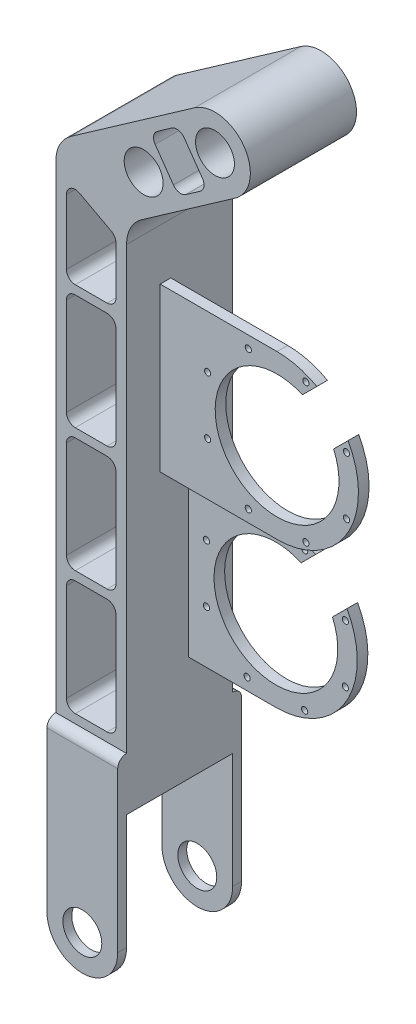
from build123d import *

# Parameters (mm, degrees)
SKETCH_1_R           = 20
SKETCH_1_R_2         = 11
EXTRUDE_1_DEPTH      = 60
EXTRUDE_2_DEPTH      = 30
SKETCH_4_R           = 11
EXTRUDE_3_DEPTH      = 5
SKETCH_8_R           = 11
CUT_EXTRUDE_1_DEPTH  = 100
FILLET_4_R           = 20
EXTRUDE_START        = -19
SKETCH_18_R          = 35
EXTRUDE_4_DEPTH      = 6
SKETCH_19_R          = 35
EXTRUDE_5_DEPTH      = 6
CUT_EXTRUDE_10_REACH = 447.736
SKETCH_22_R          = 1.75
SKETCH_23_W          = 28
SKETCH_23_H          = 65
CUT_EXTRUDE_11_DEPTH = 60
FILLET_6_R           = 5
CUT_EXTRUDE_12_REACH = 447.736


with BuildPart() as part:
    # 草图1 → 凸台-拉伸1 (new body)
    with BuildSketch(Plane.XY):
        Circle(SKETCH_1_R)
        Circle(SKETCH_1_R_2, mode=Mode.SUBTRACT)
    extrude(amount=EXTRUDE_1_DEPTH)

    # 草图2 → 凸台-拉伸2 (add, symmetric)
    with BuildSketch(Plane.XY.offset(30)):
        with BuildLine():
            Line((-11.471528727, 16.383040886), (-90, -38.603186664))
            Line((-90, -38.603186664), (-90, -349.014527675))
            Line((-90, -349.014527675), (-50, -349.014527675))
            Line((-50, -349.014527675), (-50, -59.425868686))
            Line((-50, -59.425868686), (11.471528727, -16.383040886))
            ThreePointArc((11.471528727, -16.383040886), (-16.383040886, -11.471528727), (-11.471528727, 16.383040886))
        make_face()
    extrude(amount=EXTRUDE_2_DEPTH, both=True)

    # 草图4 → 凸台-拉伸3 (add)
    with BuildSketch(Plane.XY.offset(60)):
        with BuildLine():
            Line((-90, -319.014527675), (-50, -319.014527675))
            Line((-50, -319.014527675), (-50, -414.125584817))
            ThreePointArc((-50, -414.125584817), (-70, -434.125584817), (-90, -414.125584817))
            Line((-90, -414.125584817), (-90, -319.014527675))
        make_face()
        with Locations((-70, -414.125584817)):
            Circle(SKETCH_4_R, mode=Mode.SUBTRACT)
    extrude_3 = extrude(amount=EXTRUDE_3_DEPTH)

    # 草图8 → 切除-拉伸1 (cut)
    with BuildSketch(Plane.XY.offset(60)):
        with Locations((-40.329488414, -29.555580933)):
            Circle(SKETCH_8_R)
    extrude(amount=-CUT_EXTRUDE_1_DEPTH, mode=Mode.SUBTRACT)

    # 镜向1: 凸台-拉伸3 across plane
    add(extrude_3.mirror(Plane.XY.offset(30)))

    # 圆角4
    fillet_4_edges = [part.edges().sort_by_distance(p)[0] for p in [
        (-50, -59.425868686, 30),
        (-90, -38.603186664, 30),
    ]]
    fillet(fillet_4_edges, radius=FILLET_4_R)

    # 草图18 → 凸台-拉伸4 (add)
    with BuildSketch(Plane.XY.offset(60).offset(EXTRUDE_START)):
        with BuildLine():
            Line((-50, -98.708528272), (-50, -190.708528272))
            Line((-50, -190.708528272), (16.107198554, -190.708528272))
            ThreePointArc((16.107198554, -190.708528272), (62.107198554, -144.708528272), (16.107198554, -98.708528272))
            Line((16.107198554, -98.708528272), (-50, -98.708528272))
        make_face()
        with Locations((16.107198554, -144.708528272)):
            Circle(SKETCH_18_R, mode=Mode.SUBTRACT)
    extrude(amount=-EXTRUDE_4_DEPTH)

    # 草图19 → 凸台-拉伸5 (add)
    with BuildSketch(Plane(origin=(0, 0, 0), x_dir=(-1, 0, 0), z_dir=(0, 0, -1)).offset(EXTRUDE_START)):
        with BuildLine():
            Line((50, -197.309857991), (50, -289.309857991))
            Line((50, -289.309857991), (0.559468113, -289.309857991))
            ThreePointArc((0.559468113, -289.309857991), (-45.440531887, -243.309857991), (0.559468113, -197.309857991))
            Line((0.559468113, -197.309857991), (50, -197.309857991))
        make_face()
        with Locations((0.559468113, -243.309857991)):
            Circle(SKETCH_19_R, mode=Mode.SUBTRACT)
    extrude(amount=-EXTRUDE_5_DEPTH)

    # 切除-拉伸10: up to this face of the body (flat: up to its plane)
    cut_extrude_10_end = Plane(part.part.faces().sort_by_distance((-25.279734056, -198.63548596, 19))[0])
    # 草图22 → 切除-拉伸10 (cut, up to the picked face)
    with BuildSketch(Plane.XY.offset(41), mode=Mode.PRIVATE) as cut_extrude_10_sk1:
        with Locations((32.37124443, -105.443648141)):
            Circle(SKETCH_22_R)
    cut_extrude_10_tool1 = split(extrude(cut_extrude_10_sk1.sketch, amount=-CUT_EXTRUDE_10_REACH, mode=Mode.PRIVATE), bisect_by=cut_extrude_10_end, keep=Keep.BOTH, mode=Mode.PRIVATE)
    # 草图22 → 切除-拉伸10 (cut, up to the picked face)
    with BuildSketch(Plane.XY.offset(41), mode=Mode.PRIVATE) as cut_extrude_10_sk2:
        with Locations((55.372078686, -128.444482397)):
            Circle(SKETCH_22_R)
    cut_extrude_10_tool2 = split(extrude(cut_extrude_10_sk2.sketch, amount=-CUT_EXTRUDE_10_REACH, mode=Mode.PRIVATE), bisect_by=cut_extrude_10_end, keep=Keep.BOTH, mode=Mode.PRIVATE)
    # 草图22 → 切除-拉伸10 (cut, up to the picked face)
    with BuildSketch(Plane.XY.offset(41), mode=Mode.PRIVATE) as cut_extrude_10_sk3:
        with Locations((55.372078686, -160.972574148)):
            Circle(SKETCH_22_R)
    cut_extrude_10_tool3 = split(extrude(cut_extrude_10_sk3.sketch, amount=-CUT_EXTRUDE_10_REACH, mode=Mode.PRIVATE), bisect_by=cut_extrude_10_end, keep=Keep.BOTH, mode=Mode.PRIVATE)
    # 草图22 → 切除-拉伸10 (cut, up to the picked face)
    with BuildSketch(Plane.XY.offset(41), mode=Mode.PRIVATE) as cut_extrude_10_sk4:
        with Locations((32.37124443, -183.973408404)):
            Circle(SKETCH_22_R)
    cut_extrude_10_tool4 = split(extrude(cut_extrude_10_sk4.sketch, amount=-CUT_EXTRUDE_10_REACH, mode=Mode.PRIVATE), bisect_by=cut_extrude_10_end, keep=Keep.BOTH, mode=Mode.PRIVATE)
    # 草图22 → 切除-拉伸10 (cut, up to the picked face)
    with BuildSketch(Plane.XY.offset(41), mode=Mode.PRIVATE) as cut_extrude_10_sk5:
        with Locations((-0.156847322, -183.973408404)):
            Circle(SKETCH_22_R)
    cut_extrude_10_tool5 = split(extrude(cut_extrude_10_sk5.sketch, amount=-CUT_EXTRUDE_10_REACH, mode=Mode.PRIVATE), bisect_by=cut_extrude_10_end, keep=Keep.BOTH, mode=Mode.PRIVATE)
    # 草图22 → 切除-拉伸10 (cut, up to the picked face)
    with BuildSketch(Plane.XY.offset(41), mode=Mode.PRIVATE) as cut_extrude_10_sk6:
        with Locations((-23.157681578, -160.972574148)):
            Circle(SKETCH_22_R)
    cut_extrude_10_tool6 = split(extrude(cut_extrude_10_sk6.sketch, amount=-CUT_EXTRUDE_10_REACH, mode=Mode.PRIVATE), bisect_by=cut_extrude_10_end, keep=Keep.BOTH, mode=Mode.PRIVATE)
    # 草图22 → 切除-拉伸10 (cut, up to the picked face)
    with BuildSketch(Plane.XY.offset(41), mode=Mode.PRIVATE) as cut_extrude_10_sk7:
        with Locations((-23.157681578, -128.444482397)):
            Circle(SKETCH_22_R)
    cut_extrude_10_tool7 = split(extrude(cut_extrude_10_sk7.sketch, amount=-CUT_EXTRUDE_10_REACH, mode=Mode.PRIVATE), bisect_by=cut_extrude_10_end, keep=Keep.BOTH, mode=Mode.PRIVATE)
    # 草图22 → 切除-拉伸10 (cut, up to the picked face)
    with BuildSketch(Plane.XY.offset(41), mode=Mode.PRIVATE) as cut_extrude_10_sk8:
        with Locations((-0.156847322, -105.443648141)):
            Circle(SKETCH_22_R)
    cut_extrude_10_tool8 = split(extrude(cut_extrude_10_sk8.sketch, amount=-CUT_EXTRUDE_10_REACH, mode=Mode.PRIVATE), bisect_by=cut_extrude_10_end, keep=Keep.BOTH, mode=Mode.PRIVATE)
    # 草图22 → 切除-拉伸10 (cut, up to the picked face)
    with BuildSketch(Plane.XY.offset(41), mode=Mode.PRIVATE) as cut_extrude_10_sk9:
        with Locations((15.704577763, -204.044977859)):
            Circle(SKETCH_22_R)
    cut_extrude_10_tool9 = split(extrude(cut_extrude_10_sk9.sketch, amount=-CUT_EXTRUDE_10_REACH, mode=Mode.PRIVATE), bisect_by=cut_extrude_10_end, keep=Keep.BOTH, mode=Mode.PRIVATE)
    # 草图22 → 切除-拉伸10 (cut, up to the picked face)
    with BuildSketch(Plane.XY.offset(41), mode=Mode.PRIVATE) as cut_extrude_10_sk10:
        with Locations((38.705412019, -227.045812115)):
            Circle(SKETCH_22_R)
    cut_extrude_10_tool10 = split(extrude(cut_extrude_10_sk10.sketch, amount=-CUT_EXTRUDE_10_REACH, mode=Mode.PRIVATE), bisect_by=cut_extrude_10_end, keep=Keep.BOTH, mode=Mode.PRIVATE)
    # 草图22 → 切除-拉伸10 (cut, up to the picked face)
    with BuildSketch(Plane.XY.offset(41), mode=Mode.PRIVATE) as cut_extrude_10_sk11:
        with Locations((38.705412019, -259.573903866)):
            Circle(SKETCH_22_R)
    cut_extrude_10_tool11 = split(extrude(cut_extrude_10_sk11.sketch, amount=-CUT_EXTRUDE_10_REACH, mode=Mode.PRIVATE), bisect_by=cut_extrude_10_end, keep=Keep.BOTH, mode=Mode.PRIVATE)
    # 草图22 → 切除-拉伸10 (cut, up to the picked face)
    with BuildSketch(Plane.XY.offset(41), mode=Mode.PRIVATE) as cut_extrude_10_sk12:
        with Locations((15.704577763, -282.574738122)):
            Circle(SKETCH_22_R)
    cut_extrude_10_tool12 = split(extrude(cut_extrude_10_sk12.sketch, amount=-CUT_EXTRUDE_10_REACH, mode=Mode.PRIVATE), bisect_by=cut_extrude_10_end, keep=Keep.BOTH, mode=Mode.PRIVATE)
    # 草图22 → 切除-拉伸10 (cut, up to the picked face)
    with BuildSketch(Plane.XY.offset(41), mode=Mode.PRIVATE) as cut_extrude_10_sk13:
        with Locations((-16.823513988, -282.574738122)):
            Circle(SKETCH_22_R)
    cut_extrude_10_tool13 = split(extrude(cut_extrude_10_sk13.sketch, amount=-CUT_EXTRUDE_10_REACH, mode=Mode.PRIVATE), bisect_by=cut_extrude_10_end, keep=Keep.BOTH, mode=Mode.PRIVATE)
    # 草图22 → 切除-拉伸10 (cut, up to the picked face)
    with BuildSketch(Plane.XY.offset(41), mode=Mode.PRIVATE) as cut_extrude_10_sk14:
        with Locations((-39.824348244, -259.573903866)):
            Circle(SKETCH_22_R)
    cut_extrude_10_tool14 = split(extrude(cut_extrude_10_sk14.sketch, amount=-CUT_EXTRUDE_10_REACH, mode=Mode.PRIVATE), bisect_by=cut_extrude_10_end, keep=Keep.BOTH, mode=Mode.PRIVATE)
    # 草图22 → 切除-拉伸10 (cut, up to the picked face)
    with BuildSketch(Plane.XY.offset(41), mode=Mode.PRIVATE) as cut_extrude_10_sk15:
        with Locations((-39.824348244, -227.045812115)):
            Circle(SKETCH_22_R)
    cut_extrude_10_tool15 = split(extrude(cut_extrude_10_sk15.sketch, amount=-CUT_EXTRUDE_10_REACH, mode=Mode.PRIVATE), bisect_by=cut_extrude_10_end, keep=Keep.BOTH, mode=Mode.PRIVATE)
    # 草图22 → 切除-拉伸10 (cut, up to the picked face)
    with BuildSketch(Plane.XY.offset(41), mode=Mode.PRIVATE) as cut_extrude_10_sk16:
        with Locations((-16.823513988, -204.044977859)):
            Circle(SKETCH_22_R)
    cut_extrude_10_tool16 = split(extrude(cut_extrude_10_sk16.sketch, amount=-CUT_EXTRUDE_10_REACH, mode=Mode.PRIVATE), bisect_by=cut_extrude_10_end, keep=Keep.BOTH, mode=Mode.PRIVATE)
    add(cut_extrude_10_tool1.solids().sort_by(Axis((32.371244, -105.443648, 41), (0, 0, -1)))[0], mode=Mode.SUBTRACT)
    add(cut_extrude_10_tool2.solids().sort_by(Axis((55.372079, -128.444482, 41), (0, 0, -1)))[0], mode=Mode.SUBTRACT)
    add(cut_extrude_10_tool3.solids().sort_by(Axis((55.372079, -160.972574, 41), (0, 0, -1)))[0], mode=Mode.SUBTRACT)
    add(cut_extrude_10_tool4.solids().sort_by(Axis((32.371244, -183.973408, 41), (0, 0, -1)))[0], mode=Mode.SUBTRACT)
    add(cut_extrude_10_tool5.solids().sort_by(Axis((-0.156847, -183.973408, 41), (0, 0, -1)))[0], mode=Mode.SUBTRACT)
    add(cut_extrude_10_tool6.solids().sort_by(Axis((-23.157682, -160.972574, 41), (0, 0, -1)))[0], mode=Mode.SUBTRACT)
    add(cut_extrude_10_tool7.solids().sort_by(Axis((-23.157682, -128.444482, 41), (0, 0, -1)))[0], mode=Mode.SUBTRACT)
    add(cut_extrude_10_tool8.solids().sort_by(Axis((-0.156847, -105.443648, 41), (0, 0, -1)))[0], mode=Mode.SUBTRACT)
    add(cut_extrude_10_tool9.solids().sort_by(Axis((15.704578, -204.044978, 41), (0, 0, -1)))[0], mode=Mode.SUBTRACT)
    add(cut_extrude_10_tool10.solids().sort_by(Axis((38.705412, -227.045812, 41), (0, 0, -1)))[0], mode=Mode.SUBTRACT)
    add(cut_extrude_10_tool11.solids().sort_by(Axis((38.705412, -259.573904, 41), (0, 0, -1)))[0], mode=Mode.SUBTRACT)
    add(cut_extrude_10_tool12.solids().sort_by(Axis((15.704578, -282.574738, 41), (0, 0, -1)))[0], mode=Mode.SUBTRACT)
    add(cut_extrude_10_tool13.solids().sort_by(Axis((-16.823514, -282.574738, 41), (0, 0, -1)))[0], mode=Mode.SUBTRACT)
    add(cut_extrude_10_tool14.solids().sort_by(Axis((-39.824348, -259.573904, 41), (0, 0, -1)))[0], mode=Mode.SUBTRACT)
    add(cut_extrude_10_tool15.solids().sort_by(Axis((-39.824348, -227.045812, 41), (0, 0, -1)))[0], mode=Mode.SUBTRACT)
    add(cut_extrude_10_tool16.solids().sort_by(Axis((-16.823514, -204.044978, 41), (0, 0, -1)))[0], mode=Mode.SUBTRACT)

    # 草图23 → 切除-拉伸11 (cut)
    with BuildSketch(Plane.XY.offset(60)):
        with Locations((-70, -281.514527675)):
            Rectangle(SKETCH_23_W, SKETCH_23_H)
        with Locations((-70, -211.514527675)):
            Rectangle(SKETCH_23_W, SKETCH_23_H)
        with Locations((-70, -141.514527675)):
            Rectangle(SKETCH_23_W, SKETCH_23_H)
        Polygon((-20.317350773, 2.864482075), (-36.700391659, -8.607046652), (-20.640251441, -31.543303892), (-4.257210555, -20.071775165), align=None)
        Polygon((-84, -54.014527675), (-84, -104.014527675), (-56, -104.014527675), (-56, -69.014527675), align=None)
    extrude(amount=-CUT_EXTRUDE_11_DEPTH, mode=Mode.SUBTRACT)

    # 圆角6
    fillet_6_edges = [part.edges().sort_by_distance(p)[0] for p in [
        (-70, -319.014527675, -5),
        (-70, -319.014527675, 65),
        (-84, -314.014527675, 30),
        (-56, -314.014527675, 30),
        (-56, -249.014527675, 30),
        (-84, -249.014527675, 30),
        (-84, -244.014527675, 30),
        (-56, -244.014527675, 30),
        (-84, -179.014527675, 30),
        (-56, -179.014527675, 30),
        (-84, -174.014527675, 30),
        (-56, -174.014527675, 30),
        (-84, -109.014527675, 30),
        (-56, -109.014527675, 30),
        (-20.317350773, 2.864482075, 30),
        (-36.700391659, -8.607046652, 30),
        (-20.640251441, -31.543303892, 30),
        (-4.257210555, -20.071775165, 30),
        (-84, -104.014527675, 30),
        (-56, -104.014527675, 30),
        (-56, -69.014527675, 30),
        (-84, -54.014527675, 30),
    ]]
    fillet(fillet_6_edges, radius=FILLET_6_R - 0.0001)  # a hair under: the kernel refuses the full size

    # 切除-拉伸12: up to this face of the body (flat: up to its plane)
    cut_extrude_12_end = Plane(part.part.faces().sort_by_distance((-25.279734056, -198.63548596, 19))[0])
    # 草图25 → 切除-拉伸12 (cut, up to the picked face)
    with BuildSketch(Plane.XY.offset(41), mode=Mode.PRIVATE) as cut_extrude_12_sk1:
        Polygon((24.818969666, -118.319087631), (42.496639196, -135.99675716), (62.945993982, -115.547402374), (45.268324452, -97.869732844), align=None)
    cut_extrude_12_tool1 = split(extrude(cut_extrude_12_sk1.sketch, amount=-CUT_EXTRUDE_12_REACH, mode=Mode.PRIVATE), bisect_by=cut_extrude_12_end, keep=Keep.BOTH, mode=Mode.PRIVATE)
    # 草图25 → 切除-拉伸12 (cut, up to the picked face)
    with BuildSketch(Plane.XY.offset(41), mode=Mode.PRIVATE) as cut_extrude_12_sk2:
        Polygon((7.065807559, -218.006912789), (24.743477089, -235.684582319), (48.048887013, -212.379172395), (30.371217483, -194.701502865), align=None)
    cut_extrude_12_tool2 = split(extrude(cut_extrude_12_sk2.sketch, amount=-CUT_EXTRUDE_12_REACH, mode=Mode.PRIVATE), bisect_by=cut_extrude_12_end, keep=Keep.BOTH, mode=Mode.PRIVATE)
    add(cut_extrude_12_tool1.solids().sort_by(Axis((43.882482, -116.933245, 41), (0, 0, -1)))[0], mode=Mode.SUBTRACT)
    add(cut_extrude_12_tool2.solids().sort_by(Axis((27.557347, -215.193043, 41), (0, 0, -1)))[0], mode=Mode.SUBTRACT)


solid = part.part
